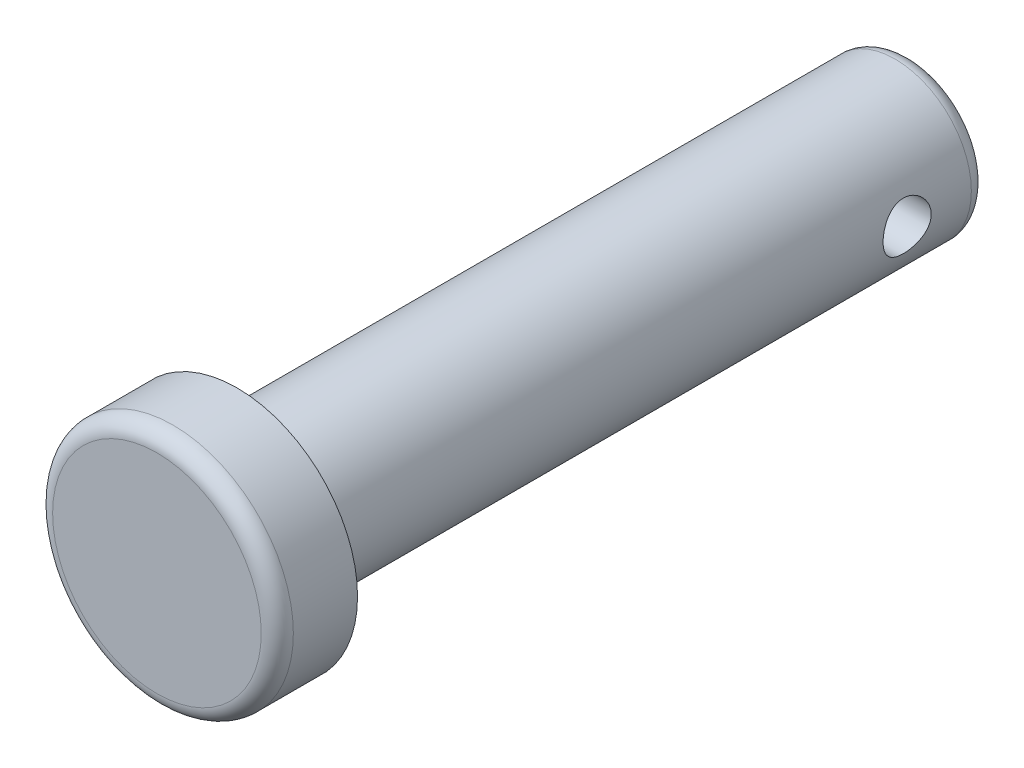
from build123d import *

# Parameters (mm, degrees)
ESQUISSE1_R                         = 7.5
BOSS_EXTRU_1_DEPTH                  = 5
CONG_1_R                            = 1
ESQUISSE12_W                        = 4.75
ESQUISSE12_H                        = 42
CONG_2_R                            = 1
ENL_V_START                         = -4.7500001
ENL_V_DE_MAT_R_VOL_MINCE2_OUTLINE_R = 1.5
ENL_V_DE_MAT_R_VOL_MINCE2_DEPTH     = 9.5000002


# Read off the part's stored shape, not the designer's step: Enlèv. de mat.-Révol.-Mince2
with BuildPart() as part:
    # Esquisse1 → Boss.-Extru.1 (new body)
    with BuildSketch(Plane.XY):
        Circle(ESQUISSE1_R)
    extrude(amount=BOSS_EXTRU_1_DEPTH)

    # Congé1
    cong_1_edges = [part.edges().sort_by_distance(p)[0] for p in [
        (-7.5, 0, 5),
    ]]
    fillet(cong_1_edges, radius=CONG_1_R)

    # Esquisse12 → Révolution1 (revolve)
    with BuildSketch(Plane(origin=(0, 0, 0), x_dir=(1, 0, 0), z_dir=(0, 1, 0))):
        with Locations((2.375, 21)):
            Rectangle(ESQUISSE12_W, ESQUISSE12_H)
    revolve(axis=Axis((0, 0, 0), (0, 0, -1)))

    # Congé2
    cong_2_edges = [part.edges().sort_by_distance(p)[0] for p in [
        (-4.75, 0, -42),
    ]]
    fillet(cong_2_edges, radius=CONG_2_R)

    # Enlèv. de mat.-Révol.-Mince2 outline → Enlèv. de mat.-Révol.-Mince2 (cut)
    with BuildSketch(Plane.YZ.offset(ENL_V_START)):
        with Locations((0, -37)):
            Circle(ENL_V_DE_MAT_R_VOL_MINCE2_OUTLINE_R)
    extrude(amount=ENL_V_DE_MAT_R_VOL_MINCE2_DEPTH, mode=Mode.SUBTRACT)


solid = part.part
